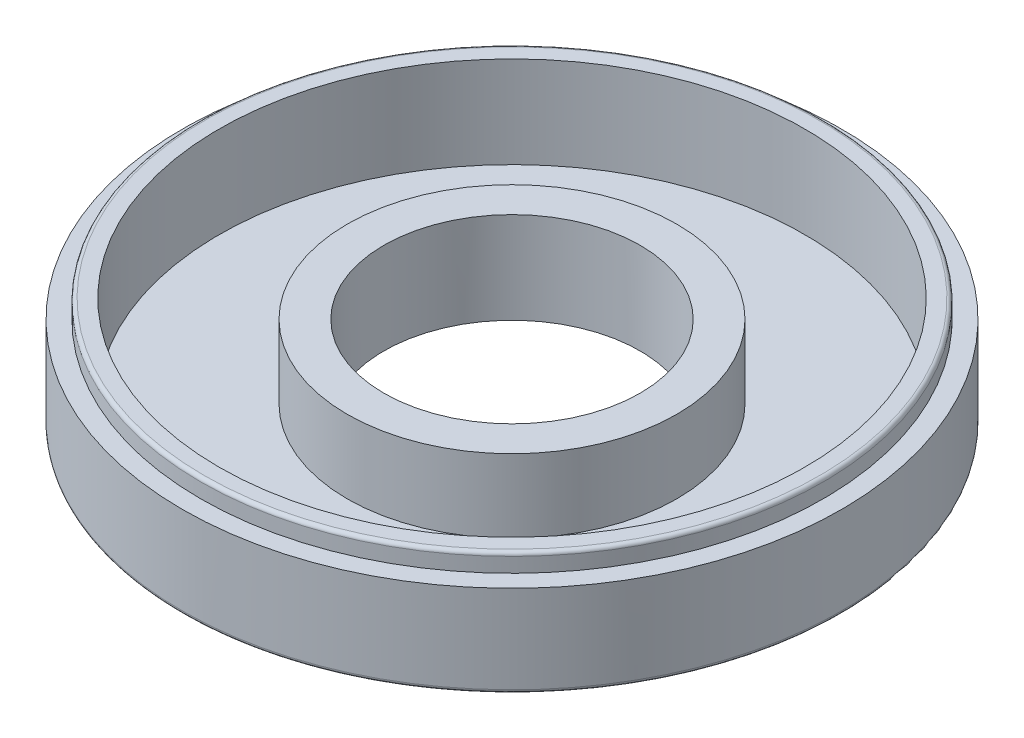
from build123d import *

# Parameters (mm, degrees)
SKETCH1_R           = 90
BOSS_EXTRUDE1_DEPTH = 30
SKETCH2_R           = 80
SKETCH2_R_2         = 45
CUT_EXTRUDE2_DEPTH  = 25
SKETCH3_R           = 35
CUT_EXTRUDE3_DEPTH  = 30
CUT_EXTRUDE6_START  = -5
SKETCH4_R           = 90
SKETCH4_R_2         = 85
CUT_EXTRUDE6_DEPTH  = 5
CUT_EXTRUDE7_DEPTH  = 3
FILLET4_R           = 5
FILLET5_R           = 5
FILLET7_R           = 1
SKETCH8_R           = 45
CUT_EXTRUDE8_DEPTH  = 5


with BuildPart() as part:
    # Sketch1 → Boss-Extrude1 (new body)
    with BuildSketch(Plane(origin=(0, 0, 0), x_dir=(1, 0, 0), z_dir=(0, 1, 0))):
        with Locations(Location((0, 0, 0), (0, 0, 270))):
            Circle(SKETCH1_R)
    extrude(amount=BOSS_EXTRUDE1_DEPTH)

    # Sketch2 → Cut-Extrude2 (cut)
    with BuildSketch(Plane(origin=(0, 30, 0), x_dir=(1, 0, 0), z_dir=(0, 1, 0))):
        with Locations(Location((0, 0, 0), (0, 0, 270))):
            Circle(SKETCH2_R)
        with Locations(Location((0, 0, 0), (0, 0, 270))):
            Circle(SKETCH2_R_2, mode=Mode.SUBTRACT)
    extrude(amount=-CUT_EXTRUDE2_DEPTH, mode=Mode.SUBTRACT)

    # Sketch3 → Cut-Extrude3 (cut)
    with BuildSketch(Plane(origin=(0, 30, 0), x_dir=(1, 0, 0), z_dir=(0, 1, 0))):
        with Locations(Location((0, 0, 0), (0, 0, 270))):
            Circle(SKETCH3_R)
    extrude(amount=-CUT_EXTRUDE3_DEPTH, mode=Mode.SUBTRACT)

    # Sketch4 → Cut-Extrude6 (cut)
    with BuildSketch(Plane(origin=(0, 30, 0), x_dir=(1, 0, 0), z_dir=(0, 1, 0)).offset(CUT_EXTRUDE6_START)):
        with Locations(Location((0, 0, 0), (0, 0, 270))):
            Circle(SKETCH4_R)
        with Locations(Location((0, 0, 0), (0, 0, 270))):
            Circle(SKETCH4_R_2, mode=Mode.SUBTRACT)
    extrude(amount=CUT_EXTRUDE6_DEPTH, mode=Mode.SUBTRACT)

    # Sketch7 → Cut-Extrude7 (cut)
    with BuildSketch(Plane(origin=(0, 0, 0), x_dir=(-1, 0, 0), z_dir=(0, -1, 0))):
        Polygon((-43.33470773, 87.639434023), (16.290699143, -18.176389433), (7.60290089, -23.128375045), (-52.007029161, 82.661204336), align=None)
    extrude(amount=-CUT_EXTRUDE7_DEPTH, mode=Mode.SUBTRACT)

    # Fillet4
    # the kernel refuses this fillet: 5 mm, written as the material it adds along each edge
    with BuildSketch(Plane(origin=(15.521035458, 3, -17.909611373), x_dir=(0, -1, 0), z_dir=(0.490907288805725, 0, -0.871211819133219))) as fillet4_piece_1_section:
        with BuildLine():
            CenterArc((5, 4.582575695), FILLET4_R, 180, 66.421821522)
            Line((0, 4.582575695), (-0.1, 4.582575695))
            Line((-0.1, 4.582575695), (-0.1, 0))
            Line((-0.1, 0), (0, -0.1))
            ThreePointArc((0, -0.1), (1.5, -0.1), (2.96, -0.091651514))
            Line((2.96, -0.091651514), (3, 0))
        make_face()
    fillet4_piece_1 = extrude(amount=78.109596927, mode=Mode.PRIVATE)
    fillet4_piece_1 = fillet4_piece_1 & Plane(origin=(0, 3, 0), x_dir=(0, 0, 1), z_dir=(0, -1, 0)) * Cylinder(90, 175, mode=Mode.PRIVATE)
    fillet4_piece_1 = fillet4_piece_1 - Plane(origin=(0, 3, 0), x_dir=(0, 0, 1), z_dir=(0, 1, 0)) * Cylinder(35, 175, mode=Mode.PRIVATE)
    add(fillet4_piece_1)

    # Fillet5
    # the kernel refuses this fillet: 5 mm, written as the material it adds along each edge
    with BuildSketch(Plane(origin=(45.139410265, 3, -90.842197657), x_dir=(0.8712093933197586, 0, 0.4909115938653498), z_dir=(-0.4909115938653499, 0, 0.8712093933197586))) as fillet5_piece_1_section:
        with BuildLine():
            CenterArc((4.582575695, -5), FILLET5_R, 90, 66.421821522)
            Line((0, -3), (-0.091651514, -2.96))
            ThreePointArc((-0.091651514, -2.96), (-0.1, -1.5), (-0.1, 0))
            Line((-0.1, 0), (0, 0.1))
            Line((0, 0.1), (4.582575695, 0.1))
            Line((4.582575695, 0.1), (4.582575695, 0))
        make_face()
    fillet5_piece_1 = extrude(amount=78.15744592, mode=Mode.PRIVATE)
    fillet5_piece_1 = fillet5_piece_1 - Plane(origin=(0, 3, 0), x_dir=(0, 0, 1), z_dir=(0, 1, 0)) * Cylinder(35, 175, mode=Mode.PRIVATE)
    fillet5_piece_1 = fillet5_piece_1 & Plane(origin=(0, 3, 0), x_dir=(0, 0, 1), z_dir=(0, -1, 0)) * Cylinder(90, 175, mode=Mode.PRIVATE)
    add(fillet5_piece_1)

    # Fillet6: read off the stored shape, not the designer's step
    # Fillet6 outline → Fillet6 (revolve, cut)
    with BuildSketch(Plane.XY):
        with BuildLine():
            ThreePointArc((90, 1), (89.707106781, 0.292893219), (89, 0))
            Line((89, 0), (90, 0))
            Line((90, 0), (90, 1))
        make_face()
    revolve(axis=Axis((0, 0, 0), (0, 1, 0)), mode=Mode.SUBTRACT)

    # Fillet7
    fillet7_edges = [part.edges().sort_by_distance(p)[0] for p in [
        (0, 30, -85),
    ]]
    fillet(fillet7_edges, radius=FILLET7_R)

    # Sketch8 → Cut-Extrude8 (cut)
    with BuildSketch(Plane(origin=(0, 30, 0), x_dir=(1, 0, 0), z_dir=(0, 1, 0))):
        with Locations(Location((0, 0, 0), (0, 0, 270))):
            Circle(SKETCH8_R)
    extrude(amount=-CUT_EXTRUDE8_DEPTH, mode=Mode.SUBTRACT)


solid = part.part
